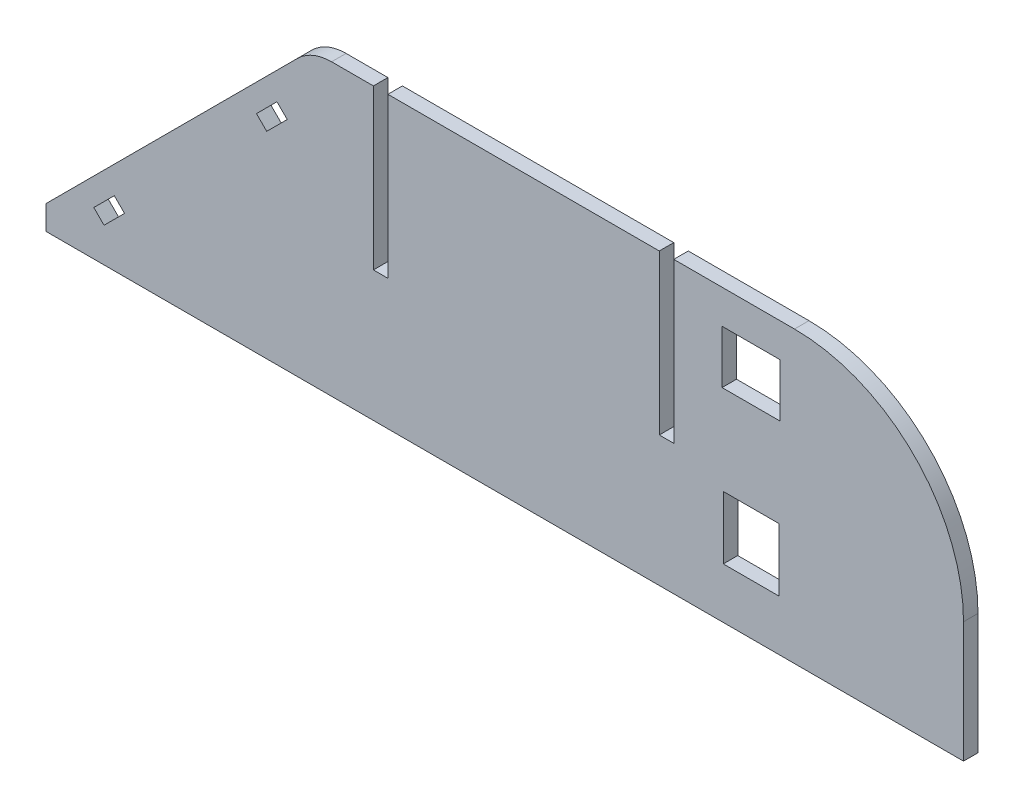
from build123d import *

# Parameters (mm, degrees)
SALIENTE_EXTRUIR1_DEPTH = 3
REDONDEO1_R             = 35
CROQUIS2_W              = 3
CROQUIS2_H              = 33
CORTAR_EXTRUIR1_DEPTH   = 100.669453696
CROQUIS3_W              = 11.5
CROQUIS3_H              = 13
CORTAR_EXTRUIR2_DEPTH   = 100.669453696
CROQUIS4_W              = 12
CROQUIS4_H              = 11
CORTAR_EXTRUIR3_DEPTH   = 100.669453696
REDONDEO2_R             = 10
CORTAR_EXTRUIR4_DEPTH   = 100.669453696


with BuildPart() as part:
    # Croquis1 → Saliente-Extruir1 (new body)
    with BuildSketch(Plane.XY):
        Polygon((-21.5, 30), (-40, 30), (-95, -25), (-95, -30), (-21.5, -30), (-18.5, -30), (95, -30), (95, 30), (-18.5, 30), align=None)
    extrude(amount=SALIENTE_EXTRUIR1_DEPTH)

    # Redondeo1
    redondeo1_edges = [part.edges().sort_by_distance(p)[0] for p in [
        (95, 30, 1.5),
    ]]
    fillet(redondeo1_edges, radius=REDONDEO1_R)

    # Croquis2 → Cortar-Extruir1 (cut, through all)
    with BuildSketch(Plane.XY.offset(3)):
        with Locations((33.5, 13.5)):
            Rectangle(CROQUIS2_W, CROQUIS2_H)
        with Locations((-25.7, 13.5)):
            Rectangle(CROQUIS2_W, CROQUIS2_H)
    extrude(amount=-CORTAR_EXTRUIR1_DEPTH, mode=Mode.SUBTRACT)

    # Croquis3 → Cortar-Extruir2 (cut, through all)
    with BuildSketch(Plane(origin=(0, 0, 0), x_dir=(-1, 0, 0), z_dir=(0, 0, -1))):
        with Locations((-51, -13)):
            Rectangle(CROQUIS3_W, CROQUIS3_H)
    extrude(amount=-CORTAR_EXTRUIR2_DEPTH, mode=Mode.SUBTRACT)

    # Croquis4 → Cortar-Extruir3 (cut, through all)
    with BuildSketch(Plane(origin=(0, 0, 0), x_dir=(-1, 0, 0), z_dir=(0, 0, -1))):
        with Locations((-51, 17.5)):
            Rectangle(CROQUIS4_W, CROQUIS4_H)
    extrude(amount=-CORTAR_EXTRUIR3_DEPTH, mode=Mode.SUBTRACT)

    # Redondeo2
    redondeo2_edges = [part.edges().sort_by_distance(p)[0] for p in [
        (-40, 30, 1.5),
    ]]
    fillet(redondeo2_edges, radius=REDONDEO2_R)

    # Croquis5 → Cortar-Extruir4 (cut, through all)
    with BuildSketch(Plane(origin=(0, 0, 0), x_dir=(-1, 0, 0), z_dir=(0, 0, -1))):
        Polygon((47.171572875, 17.171572875), (45.050252532, 15.050252532), (49.292893219, 10.807611845), (51.414213562, 12.928932188), align=None)
        Polygon((85.100505063, -20.757359313), (82.97918472, -22.878679656), (78.736544033, -18.636038969), (80.857864376, -16.514718626), align=None)
    extrude(amount=-CORTAR_EXTRUIR4_DEPTH, mode=Mode.SUBTRACT)


solid = part.part
